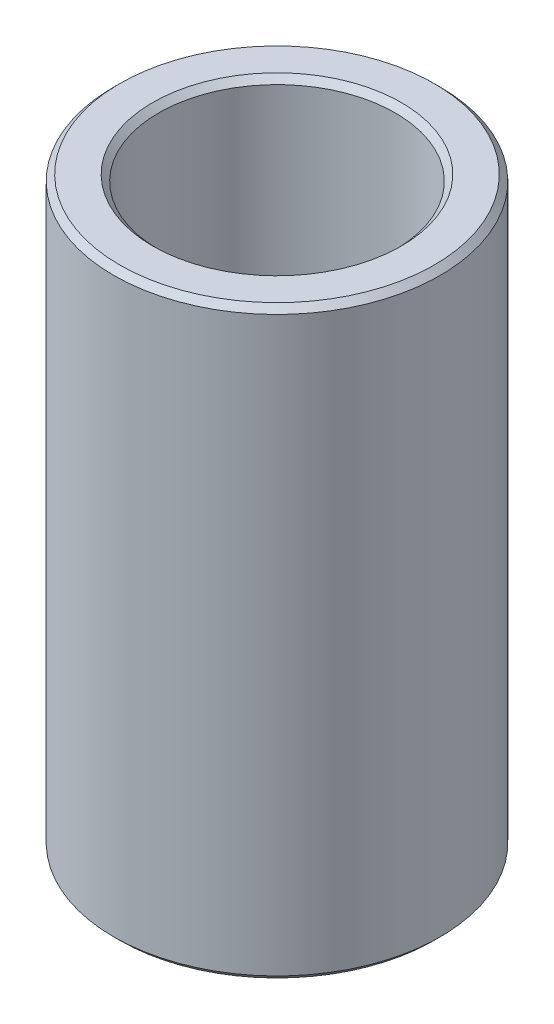
from build123d import *

# Parameters (mm, degrees)
SKETCH1_R           = 25
BOSS_EXTRUDE1_DEPTH = 89.594314063
SKETCH2_R           = 18.128575836
CUT_EXTRUDE1_DEPTH  = 97.317916882
CHAMFER1_SIZE       = 0.918779768


with BuildPart() as part:
    # Sketch1 → Boss-Extrude1 (new body)
    with BuildSketch(Plane(origin=(0, 0, 0), x_dir=(1, 0, 0), z_dir=(0, 1, 0))):
        Circle(SKETCH1_R)
    extrude(amount=BOSS_EXTRUDE1_DEPTH)

    # Sketch2 → Cut-Extrude1 (cut, through all)
    with BuildSketch(Plane(origin=(0, 0, 0), x_dir=(1, 0, 0), z_dir=(0, 1, 0))):
        Circle(SKETCH2_R)
    extrude(amount=CUT_EXTRUDE1_DEPTH, mode=Mode.SUBTRACT)

    # Chamfer1
    chamfer1_edges = [part.edges().sort_by_distance(p)[0] for p in [
        (-18.128575836, 89.594314063, 0),
        (-18.128575836, 0, 0),
        (-25, 0, 0),
        (-25, 89.594314063, 0),
    ]]
    chamfer(chamfer1_edges, length=CHAMFER1_SIZE)


solid = part.part
